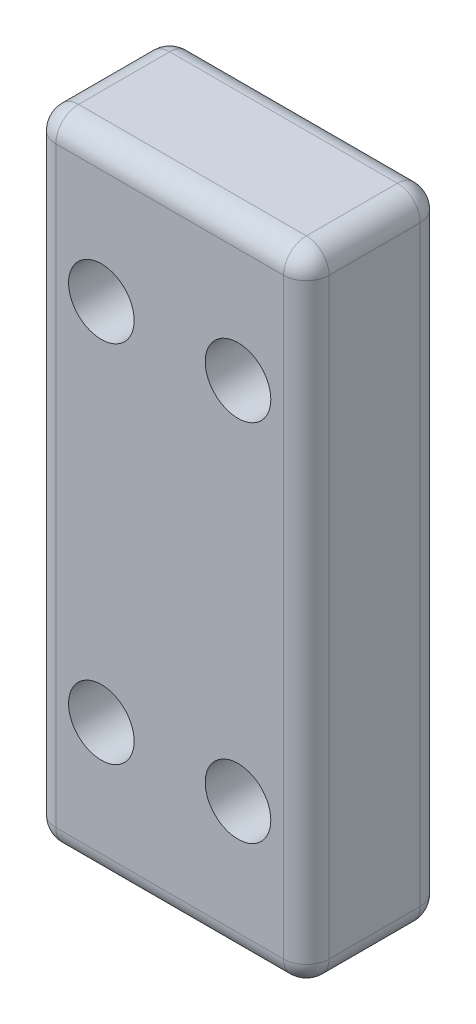
from build123d import *

# Parameters (mm, degrees)
SKETCH1_W           = 19.05
SKETCH1_H           = 44.45
BOSS_EXTRUDE1_DEPTH = 9.525
SKETCH2_R           = 2.286
CUT_EXTRUDE1_DEPTH  = 50.289254661
FILLET1_R           = 1.5875


with BuildPart() as part:
    # Sketch1 → Boss-Extrude1 (new body)
    with BuildSketch(Plane.XY):
        with Locations((9.525, 22.225)):
            Rectangle(SKETCH1_W, SKETCH1_H)
    extrude(amount=BOSS_EXTRUDE1_DEPTH)

    # Sketch2 → Cut-Extrude1 (cut, through all)
    with BuildSketch(Plane.XY.offset(9.525)):
        with Locations((4.7625, 34.925)):
            Circle(SKETCH2_R)
        with Locations((14.2875, 34.925)):
            Circle(SKETCH2_R)
        with Locations((4.7625, 9.525)):
            Circle(SKETCH2_R)
        with Locations((14.2875, 9.525)):
            Circle(SKETCH2_R)
    extrude(amount=-CUT_EXTRUDE1_DEPTH, mode=Mode.SUBTRACT)

    # Fillet1
    fillet1_edges = [part.edges().sort_by_distance(p)[0] for p in [
        (0, 22.225, 9.525),
        (0, 22.225, 0),
        (0, 0, 4.7625),
        (9.525, 0, 9.525),
        (9.525, 0, 0),
        (19.05, 0, 4.7625),
        (19.05, 22.225, 9.525),
        (19.05, 22.225, 0),
        (19.05, 44.45, 4.7625),
        (9.525, 44.45, 9.525),
        (0, 44.45, 4.7625),
        (9.525, 44.45, 0),
    ]]
    fillet(fillet1_edges, radius=FILLET1_R)


solid = part.part
